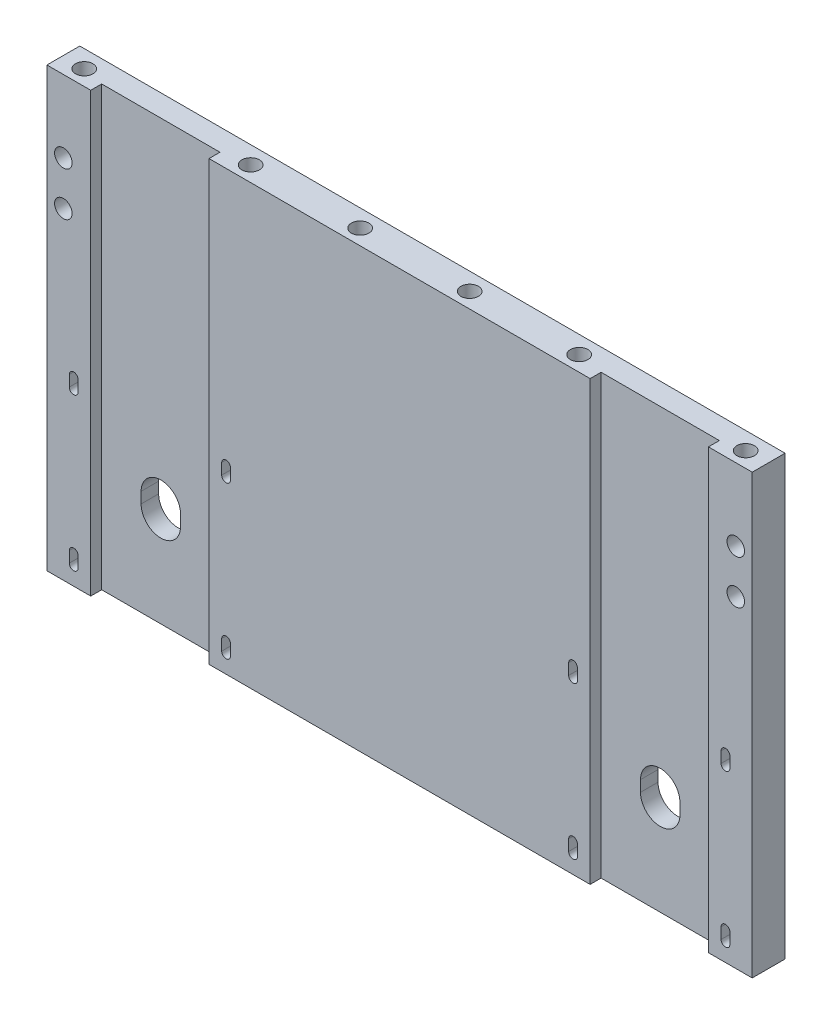
from build123d import *

# Parameters (mm, degrees)
SZKIC1_W                    = 322
SZKIC1_H                    = 200
DODANIE_WYCI_GNI_CIE1_DEPTH = 15
SZKIC3_W                    = 54
SZKIC3_H                    = 200
WYTNIJ_WYCI_GNI_CIE1_DEPTH  = 5
WYTNIJ_WYCI_GNI_CIE2_DEPTH  = 17.75
SZYK_LINIOWY1_COUNT         = 2
SZYK_LINIOWY1_PITCH         = 69.6
SZYK_LINIOWY1_COUNT_DIR2    = 2
SZYK_LINIOWY1_PITCH_DIR2    = 69.6
WYTNIJ_WYCI_GNI_CIE3_DEPTH  = 2
WYTNIJ_WYCI_GNI_CIE4_DEPTH  = 17.75
SZYK_LINIOWY2_COUNT         = 2
SZYK_LINIOWY2_PITCH         = 228
SZYK_LINIOWY2_COPY_1_DEPTH  = 17.75
SZYK_LINIOWY2_COPY_2_DEPTH  = 17.75
SZYK_LINIOWY2_COPY_3_DEPTH  = 17.75
SZKIC8_R                    = 4
WYTNIJ_WYCI_GNI_CIE5_DEPTH  = 20
SZKIC9_R                    = 4
WYTNIJ_WYCI_GNI_CIE6_DEPTH  = 20
SZYK_LINIOWY3_COUNT         = 4
SZYK_LINIOWY3_PITCH         = 50
SZKIC10_R                   = 4
WYTNIJ_WYCI_GNI_CIE7_DEPTH  = 20
SZKIC11_R                   = 4
WYTNIJ_WYCI_GNI_CIE8_DEPTH  = 20


with BuildPart() as part:
    # Szkic1 → Dodanie-wyciągnięcie1 (new body)
    with BuildSketch(Plane.XY):
        Rectangle(SZKIC1_W, SZKIC1_H)
    extrude(amount=DODANIE_WYCI_GNI_CIE1_DEPTH)

    # Szkic3 → Wytnij-wyciągnięcie1 (cut)
    with BuildSketch(Plane.XY.offset(15)):
        with Locations((-114, 0)):
            Rectangle(SZKIC3_W, SZKIC3_H)
        with Locations((114, 0)):
            Rectangle(SZKIC3_W, SZKIC3_H)
    extrude(amount=-WYTNIJ_WYCI_GNI_CIE1_DEPTH, mode=Mode.SUBTRACT)

    # Szkic2 → Wytnij-wyciągnięcie2 (cut)
    with BuildSketch(Plane.XY.offset(15)):
        with BuildLine():
            ThreePointArc((-146.8, -86.87), (-148.8, -84.87), (-150.8, -86.87))
            Line((-150.8, -86.87), (-150.8, -91.87))
            ThreePointArc((-150.8, -91.87), (-148.8, -93.87), (-146.8, -91.87))
            Line((-146.8, -91.87), (-146.8, -86.87))
        make_face()
    wytnij_wyci_gni_cie2 = extrude(amount=-WYTNIJ_WYCI_GNI_CIE2_DEPTH, mode=Mode.SUBTRACT)

    # Szyk liniowy1: Wytnij-wyci_gni_cie2 2 × 2
    with Locations(*[(i * SZYK_LINIOWY1_PITCH, j * SZYK_LINIOWY1_PITCH_DIR2, 0) for i in range(SZYK_LINIOWY1_COUNT) for j in range(SZYK_LINIOWY1_COUNT_DIR2) if (i, j) != (0, 0)]):
        add(wytnij_wyci_gni_cie2, mode=Mode.SUBTRACT)

    # Szkic5 → Wytnij-wyciągnięcie3 (cut)
    with BuildSketch(Plane(origin=(0, 0, 0), x_dir=(-1, 0, 0), z_dir=(0, 0, -1))):
        with BuildLine():
            ThreePointArc((77.5, -57.07), (114, -93.57), (150.5, -57.07))
            Line((150.5, -57.07), (150.5, -52.07))
            ThreePointArc((150.5, -52.07), (114, -15.57), (77.5, -52.07))
            Line((77.5, -52.07), (77.5, -57.07))
        make_face()
    wytnij_wyci_gni_cie3 = extrude(amount=-WYTNIJ_WYCI_GNI_CIE3_DEPTH, mode=Mode.SUBTRACT)

    # Szkic7 → Wytnij-wyciągnięcie4 (cut)
    with BuildSketch(Plane(origin=(0, 0, 2), x_dir=(-1, 0, 0), z_dir=(0, 0, -1))):
        with BuildLine():
            ThreePointArc((123, -52.07), (114, -43.07), (105, -52.07))
            Line((105, -52.07), (105, -57.07))
            ThreePointArc((105, -57.07), (114, -66.07), (123, -57.07))
            Line((123, -57.07), (123, -52.07))
        make_face()
    wytnij_wyci_gni_cie4 = extrude(amount=-WYTNIJ_WYCI_GNI_CIE4_DEPTH, mode=Mode.SUBTRACT)

    # Szyk liniowy2: Wytnij-wyciągnięcie2, Wytnij-wyciągnięcie3, Wytnij-wyciągnięcie4 ×2
    with Locations(*[(i * SZYK_LINIOWY2_PITCH, 0, 0) for i in range(1, SZYK_LINIOWY2_COUNT)]):
        add(wytnij_wyci_gni_cie2, mode=Mode.SUBTRACT)
        add(wytnij_wyci_gni_cie3, mode=Mode.SUBTRACT)
        add(wytnij_wyci_gni_cie4, mode=Mode.SUBTRACT)

    # Szyk liniowy2 copy 1 sketch → Szyk liniowy2 copy 1 (cut)
    with BuildSketch(Plane(origin=(228, 69.6, 15), x_dir=(1, 0, 0), z_dir=(0, 0, 1))):
        with BuildLine():
            ThreePointArc((-146.8, -86.87), (-148.8, -84.87), (-150.8, -86.87))
            Line((-150.8, -86.87), (-150.8, -91.87))
            ThreePointArc((-150.8, -91.87), (-148.8, -93.87), (-146.8, -91.87))
            Line((-146.8, -91.87), (-146.8, -86.87))
        make_face()
    extrude(amount=-SZYK_LINIOWY2_COPY_1_DEPTH, mode=Mode.SUBTRACT)

    # Szyk liniowy2 copy 2 sketch → Szyk liniowy2 copy 2 (cut)
    with BuildSketch(Plane(origin=(297.6, 0, 15), x_dir=(1, 0, 0), z_dir=(0, 0, 1))):
        with BuildLine():
            ThreePointArc((-146.8, -86.87), (-148.8, -84.87), (-150.8, -86.87))
            Line((-150.8, -86.87), (-150.8, -91.87))
            ThreePointArc((-150.8, -91.87), (-148.8, -93.87), (-146.8, -91.87))
            Line((-146.8, -91.87), (-146.8, -86.87))
        make_face()
    extrude(amount=-SZYK_LINIOWY2_COPY_2_DEPTH, mode=Mode.SUBTRACT)

    # Szyk liniowy2 copy 3 sketch → Szyk liniowy2 copy 3 (cut)
    with BuildSketch(Plane(origin=(297.6, 69.6, 15), x_dir=(1, 0, 0), z_dir=(0, 0, 1))):
        with BuildLine():
            ThreePointArc((-146.8, -86.87), (-148.8, -84.87), (-150.8, -86.87))
            Line((-150.8, -86.87), (-150.8, -91.87))
            ThreePointArc((-150.8, -91.87), (-148.8, -93.87), (-146.8, -91.87))
            Line((-146.8, -91.87), (-146.8, -86.87))
        make_face()
    extrude(amount=-SZYK_LINIOWY2_COPY_3_DEPTH, mode=Mode.SUBTRACT)

    # Szkic8 → Wytnij-wyciągnięcie5 (cut)
    with BuildSketch(Plane(origin=(0, 100, 0), x_dir=(1, 0, 0), z_dir=(0, 1, 0))):
        with Locations((-151, -8)):
            Circle(SZKIC8_R)
        with Locations((151, -8)):
            Circle(SZKIC8_R)
    extrude(amount=-WYTNIJ_WYCI_GNI_CIE5_DEPTH, mode=Mode.SUBTRACT)

    # Szkic9 → Wytnij-wyciągnięcie6 (cut)
    with BuildSketch(Plane(origin=(0, 100, 0), x_dir=(1, 0, 0), z_dir=(0, 1, 0))):
        with Locations((-75, -8)):
            Circle(SZKIC9_R)
    wytnij_wyci_gni_cie6 = extrude(amount=-WYTNIJ_WYCI_GNI_CIE6_DEPTH, mode=Mode.SUBTRACT)

    # Szyk liniowy3: Wytnij-wyciągnięcie6 ×4
    with Locations(*[(i * SZYK_LINIOWY3_PITCH, 0, 0) for i in range(1, SZYK_LINIOWY3_COUNT)]):
        add(wytnij_wyci_gni_cie6, mode=Mode.SUBTRACT)

    # Szkic10 → Wytnij-wyciągnięcie7 (cut)
    with BuildSketch(Plane.XY.offset(15)):
        with Locations((-153.5, 67)):
            Circle(SZKIC10_R)
        with Locations((-153.5, 47)):
            Circle(SZKIC10_R)
    extrude(amount=-WYTNIJ_WYCI_GNI_CIE7_DEPTH, mode=Mode.SUBTRACT)

    # Szkic11 → Wytnij-wyciągnięcie8 (cut)
    with BuildSketch(Plane.XY.offset(15)):
        with Locations((153.5, 47)):
            Circle(SZKIC11_R)
        with Locations((153.5, 67)):
            Circle(SZKIC11_R)
    extrude(amount=-WYTNIJ_WYCI_GNI_CIE8_DEPTH, mode=Mode.SUBTRACT)


solid = part.part
